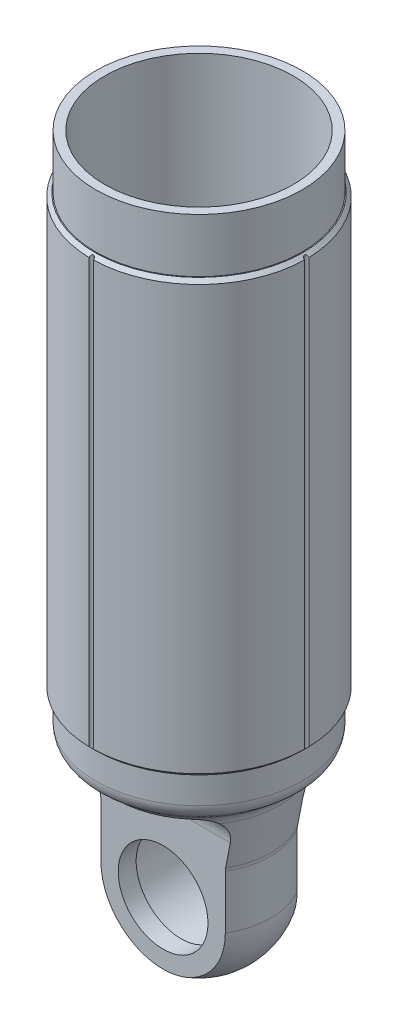
from build123d import *

# Parameters (mm, degrees)
EXTRUDE1_START     = -12.045798447
EXTRUDE1_DEPTH     = 24.09159688
SKETCH5_R          = 7.9375
EXTRUDE2_DEPTH     = 131.908603613
SKETCH6_R          = 9.525
EXTRUDE3_DEPTH     = 131.329786024
EXTRUDE6_REACH     = 131.826
SKETCH7_R          = 16.66875
SKETCH14_R         = 5.75437
CUT_EXTRUDE1_DEPTH = 131.077196307
SKETCH10_R         = 0.396875
EXTRUDE7_DEPTH     = 121.52460589


with BuildPart() as part:
    # Sketch1 → Revolve1 (revolve)
    with BuildSketch(Plane(origin=(0, 0, 0), x_dir=(0, 0, -1), z_dir=(1, 0, 0))):
        with BuildLine():
            Line((0, 0), (-18.25625, 0))
            Line((-18.25625, 0), (-18.25625, -9.525))
            Line((-18.25625, -9.525), (-18.415, -9.525))
            Line((-18.415, -9.525), (-19.05, -10.16))
            Line((-19.05, -10.16), (-19.05, -85.09))
            Line((-19.05, -85.09), (-18.415, -85.725))
            Line((-18.415, -85.725), (-18.25625, -85.725))
            Line((-18.25625, -85.725), (-18.25625, -90.549016109))
            ThreePointArc((-18.25625, -90.549016109), (-17.942887775, -91.924390329), (-17.064656776, -93.028274579))
            Line((-17.064656776, -93.028274579), (-15.230875616, -94.495299508))
            ThreePointArc((-15.230875616, -94.495299508), (-14.478835201, -95.362741093), (-14.084448529, -96.440924215))
            Line((-14.084448529, -96.440924215), (-12.745166137, -104.295995752))
            ThreePointArc((-12.745166137, -104.295995752), (-12.711311685, -104.561858637), (-12.7, -104.829629515))
            Line((-12.7, -104.829629515), (-12.7, -114.3))
            ThreePointArc((-12.7, -114.3), (-8.980256121, -123.280256121), (0, -127))
            Line((0, -127), (0, 0))
        make_face()
    revolve(axis=Axis((0, 0, 0), (0, -1, 0)))

    # Extrude1: read off the stored shape, not the designer's step
    # Extrude1 outline → Extrude1 (cut)
    with BuildSketch(Plane(origin=(0, 0, 0), x_dir=(0, 0, -1), z_dir=(1, 0, 0)).offset(EXTRUDE1_START)):
        with BuildLine():
            Line((-6.35, -127), (-6.35, -100.0125))
            ThreePointArc((-6.35, -100.0125), (-7.744903975, -96.644903935), (-11.112500057, -95.25))
            Line((-11.112500057, -95.25), (-16, -95.25))
            Line((-16, -95.25), (-16, -127))
            Line((-16, -127), (-6.35, -127))
        make_face()
        with BuildLine():
            Line((6.35, -100.0125), (6.35, -127))
            Line((6.35, -127), (16, -127))
            Line((16, -127), (16, -95.25))
            Line((16, -95.25), (11.112500057, -95.25))
            ThreePointArc((11.112500057, -95.25), (7.744903975, -96.644903935), (6.35, -100.0125))
        make_face()
    extrude(amount=EXTRUDE1_DEPTH, mode=Mode.SUBTRACT)

    # Sketch5 → Extrude2 (cut, through all)
    with BuildSketch(Plane.XY.offset(6.35)):
        with Locations((0, -114.3)):
            Circle(SKETCH5_R)
    extrude(amount=-EXTRUDE2_DEPTH, mode=Mode.SUBTRACT)

    # Sketch6 → Extrude3 (cut, through all)
    with BuildSketch(Plane.XY.offset(3.175)):
        with Locations((0, -114.3)):
            Circle(SKETCH6_R)
    extrude(amount=-EXTRUDE3_DEPTH, mode=Mode.SUBTRACT)

    # Extrude6: up to this cone (the profile starts inside it)
    extrude6_end = Plane(origin=(0, 0, 0), z_dir=(0, 1, 0)).offset(-102.614015109) * Cone(1.25e-06, 454.009420307, 363.207535246, align=(Align.CENTER, Align.CENTER, Align.MIN), mode=Mode.PRIVATE)
    # Sketch7 → Extrude6 (cut, up to the surface)
    with BuildSketch(Plane(origin=(0, 0, 0), x_dir=(-1, 0, 0), z_dir=(0, 1, 0)), mode=Mode.PRIVATE) as extrude6_sk1:
        with Locations(Location((0, 0, 0), (0, 0, 90))):
            Circle(SKETCH7_R)
    extrude6_tool1 = extrude(extrude6_sk1.sketch, amount=-EXTRUDE6_REACH, mode=Mode.PRIVATE) & extrude6_end
    add(extrude6_tool1.solids().sort_by_distance((0, 0, 0))[0], mode=Mode.SUBTRACT)

    # Sketch9 → 1/2-20 Tapped Hole1 (revolve, cut)
    with BuildSketch(Plane(origin=(-13.385797835, -100.538604596, 0), x_dir=(0.16807362604569848, -0.9857744449050456, 0), z_dir=(0, 0, 1))):
        Polygon((0, 0), (0, 22.50757432), (5.75437, 19.05), (5.75437, 0), align=None)
    revolve(axis=Axis((-19.64546556, -101.605872121, 0), (0.9857744449050456, 0.16807362604569842, 0)), mode=Mode.SUBTRACT)

    # Sketch14 → Cut-Extrude1 (cut, through all)
    with BuildSketch(Plane(origin=(-10.886168684, -1.856081636, 0), x_dir=(0, 0, 1), z_dir=(-0.9857744449050456, -0.16807362604569862, 0))):
        with Locations(Location((0, -96.858587557, 0), (0, 0, 230.435241051))):
            Circle(SKETCH14_R)
    extrude(amount=CUT_EXTRUDE1_DEPTH, mode=Mode.SUBTRACT)

    # Sketch10 → Extrude7 (cut, through all)
    with BuildSketch(Plane(origin=(0, -9.525, 0), x_dir=(-1, 0, 0), z_dir=(0, 1, 0))):
        with Locations((0, -19.05)):
            Circle(SKETCH10_R)
        with Locations((-19.05, 0)):
            Circle(SKETCH10_R)
        with Locations((0, 19.05)):
            Circle(SKETCH10_R)
        with Locations((19.05, 0)):
            Circle(SKETCH10_R)
    extrude(amount=-EXTRUDE7_DEPTH, mode=Mode.SUBTRACT)


solid = part.part
